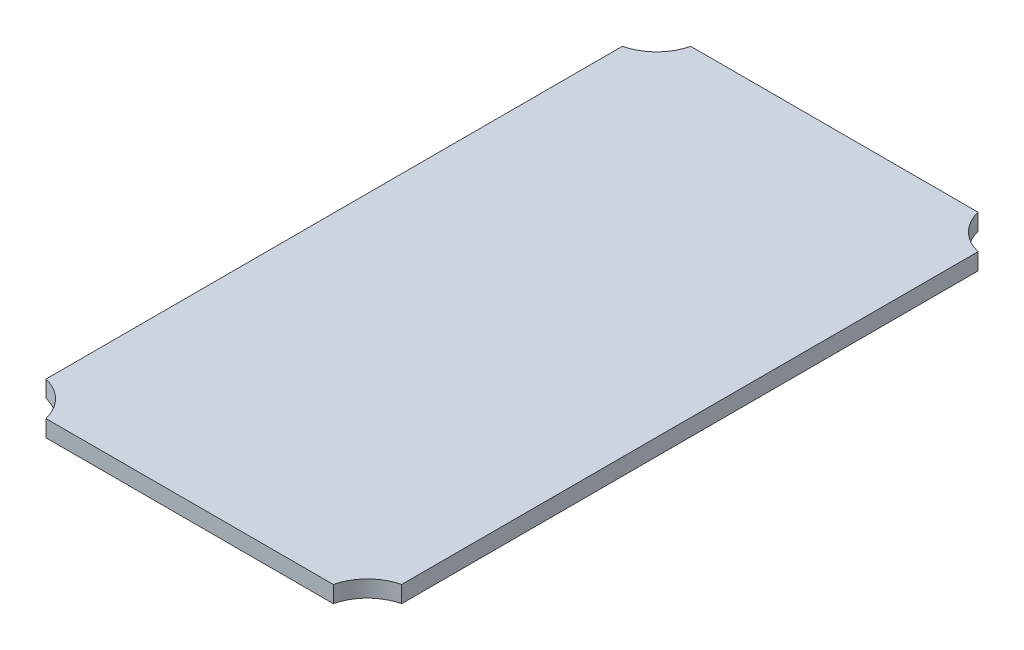
from build123d import *

# Parameters (mm, degrees)
SKETCH1_W           = 34
SKETCH1_H           = 60
BOSS_EXTRUDE1_DEPTH = 1.5
CUT_EXTRUDE2_DEPTH  = 1.5
SKETCH6_OUTSIDE_W   = 49.796
SKETCH6_OUTSIDE_H   = 75.796
SKETCH6_OUTSIDE_W_2 = 32
SKETCH6_OUTSIDE_H_2 = 58
CUT_EXTRUDE3_DEPTH  = 1.5


with BuildPart() as part:
    # Sketch1 → Boss-Extrude1 (new body)
    with BuildSketch(Plane(origin=(0, 0, 0), x_dir=(1, 0, 0), z_dir=(0, 1, 0))):
        Rectangle(SKETCH1_W, SKETCH1_H)
    extrude(amount=BOSS_EXTRUDE1_DEPTH)

    # Sketch5 → Cut-Extrude2 (cut)
    with BuildSketch(Plane(origin=(0, 1.5, 0), x_dir=(1, 0, 0), z_dir=(0, 1, 0))):
        with BuildLine():
            Line((-17, 25.8), (-17, 30))
            Line((-17, 30), (-12.8, 30))
            ThreePointArc((-12.8, 30), (-14.030151519, 27.030151519), (-17, 25.8))
        make_face()
        with BuildLine():
            Line((17, 30), (12.8, 30))
            ThreePointArc((12.8, 30), (14.030151519, 27.030151519), (17, 25.8))
            Line((17, 25.8), (17, 30))
        make_face()
        with BuildLine():
            Line((17, -25.8), (17, -30))
            Line((17, -30), (12.8, -30))
            ThreePointArc((12.8, -30), (14.030151519, -27.030151519), (17, -25.8))
        make_face()
        with BuildLine():
            Line((-17, -30), (-12.8, -30))
            ThreePointArc((-12.8, -30), (-14.030151519, -27.030151519), (-17, -25.8))
            Line((-17, -25.8), (-17, -30))
        make_face()
    extrude(amount=-CUT_EXTRUDE2_DEPTH, mode=Mode.SUBTRACT)

    # Sketch6 outside → Cut-Extrude3 (cut)
    with BuildSketch(Plane(origin=(0, 1.5, 0), x_dir=(1, 0, 0), z_dir=(0, 1, 0))):
        Rectangle(SKETCH6_OUTSIDE_W, SKETCH6_OUTSIDE_H)
        Rectangle(SKETCH6_OUTSIDE_W_2, SKETCH6_OUTSIDE_H_2, mode=Mode.SUBTRACT)
    extrude(amount=-CUT_EXTRUDE3_DEPTH, mode=Mode.SUBTRACT)


solid = part.part
